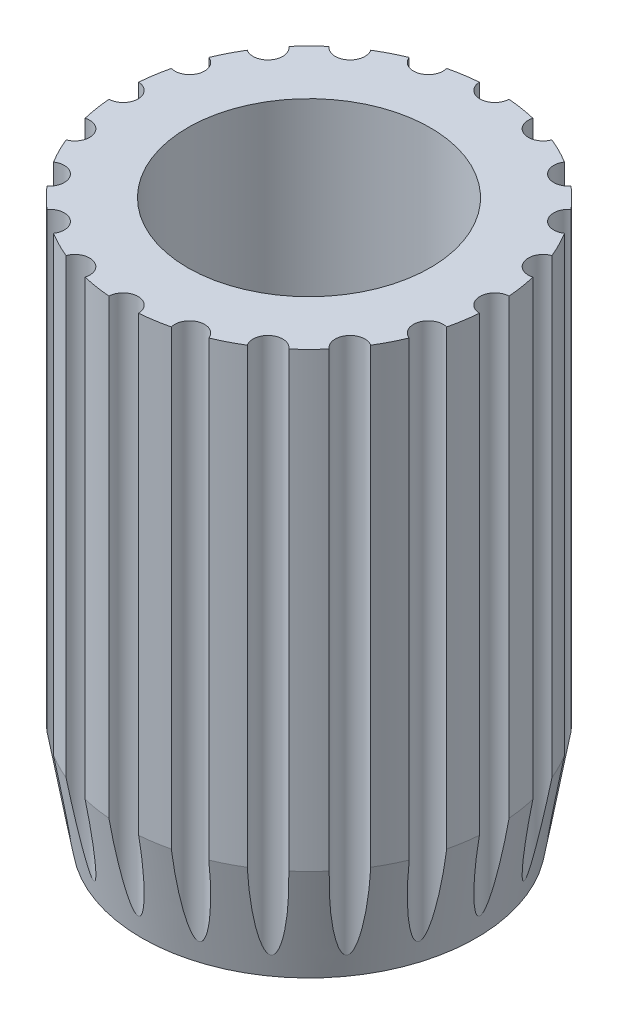
from build123d import *

# Parameters (mm, degrees)
SKETCH1_R                    = 5
BOSS_EXTRUDE1_DEPTH          = 15
F_5_16_18_TAPPED_HOLE1_D     = 6.5278
F_5_16_18_TAPPED_HOLE1_DEPTH = 10
F_5_16_18_TAPPED_HOLE1_TIP   = 1.961148974
CHAMFER1_SIZE                = 0.5
CHAMFER1_SIZE2               = 2.83564091
SKETCH5_R                    = 0.4
CUT_EXTRUDE2_DEPTH           = 17.583123952


# Read off the part's stored shape, not the designer's step: Cut-Loft1
with BuildPart() as part:
    # Sketch1 → Boss-Extrude1 (new body)
    with BuildSketch(Plane(origin=(0, 0, 0), x_dir=(1, 0, 0), z_dir=(0, 1, 0))):
        with Locations(Location((0, 0, 0), (0, 0, 270))):
            Circle(SKETCH1_R)
    extrude(amount=BOSS_EXTRUDE1_DEPTH)

    # 5/16-18 Tapped Hole1
    with Locations(Plane(origin=(0, 15, 0), x_dir=(1, 0, 0), z_dir=(0, 1, 0))):
        with Locations((0, 0)):
            Hole(F_5_16_18_TAPPED_HOLE1_D / 2, depth=F_5_16_18_TAPPED_HOLE1_DEPTH)
            with Locations((0, 0, -(F_5_16_18_TAPPED_HOLE1_DEPTH + F_5_16_18_TAPPED_HOLE1_TIP / 2))):  # 118° drill point
                Cone(0, F_5_16_18_TAPPED_HOLE1_D / 2, F_5_16_18_TAPPED_HOLE1_TIP, mode=Mode.SUBTRACT)

    # Cut-Loft1 outline → Cut-Loft1 (revolve, cut)
    with BuildSketch(Plane.XY):
        Polygon((2.5, 0), (3.2639, 5), (0, 3.038851026), (0, 0), align=None)
    revolve(axis=Axis((0, 0, 0), (0, 1, 0)), mode=Mode.SUBTRACT)

    # Chamfer1
    chamfer1_edges = [part.edges().sort_by_distance(p)[0] for p in [
        (0, 0, -5),
    ]]
    chamfer1_side = [part.faces().sort_by_distance(p)[0] for p in [
        (0, 0, -4.858578644),
    ]]
    chamfer(chamfer1_edges, length=CHAMFER1_SIZE, length2=CHAMFER1_SIZE2, reference=chamfer1_side[0])

    # Sketch5 → Cut-Extrude2 (cut, through all)
    with BuildSketch(Plane(origin=(0, 15, 0), x_dir=(1, 0, 0), z_dir=(0, 1, 0))):
        with Locations((0, 5)):
            Circle(SKETCH5_R)
        with Locations((1.545084972, 4.755282581)):
            Circle(SKETCH5_R)
        with Locations((2.938926261, 4.045084972)):
            Circle(SKETCH5_R)
        with Locations((4.045084972, 2.938926261)):
            Circle(SKETCH5_R)
        with Locations((4.755282581, 1.545084972)):
            Circle(SKETCH5_R)
        with Locations((5, 0)):
            Circle(SKETCH5_R)
        with Locations((4.755282581, -1.545084972)):
            Circle(SKETCH5_R)
        with Locations((4.045084972, -2.938926261)):
            Circle(SKETCH5_R)
        with Locations((2.938926261, -4.045084972)):
            Circle(SKETCH5_R)
        with Locations((1.545084972, -4.755282581)):
            Circle(SKETCH5_R)
        with Locations((0, -5)):
            Circle(SKETCH5_R)
        with Locations((-1.545084972, -4.755282581)):
            Circle(SKETCH5_R)
        with Locations((-2.938926261, -4.045084972)):
            Circle(SKETCH5_R)
        with Locations((-4.045084972, -2.938926261)):
            Circle(SKETCH5_R)
        with Locations((-4.755282581, -1.545084972)):
            Circle(SKETCH5_R)
        with Locations((-5, 0)):
            Circle(SKETCH5_R)
        with Locations((-4.755282581, 1.545084972)):
            Circle(SKETCH5_R)
        with Locations((-4.045084972, 2.938926261)):
            Circle(SKETCH5_R)
        with Locations((-2.938926261, 4.045084972)):
            Circle(SKETCH5_R)
        with Locations((-1.545084972, 4.755282581)):
            Circle(SKETCH5_R)
    extrude(amount=-CUT_EXTRUDE2_DEPTH, mode=Mode.SUBTRACT)


solid = part.part
